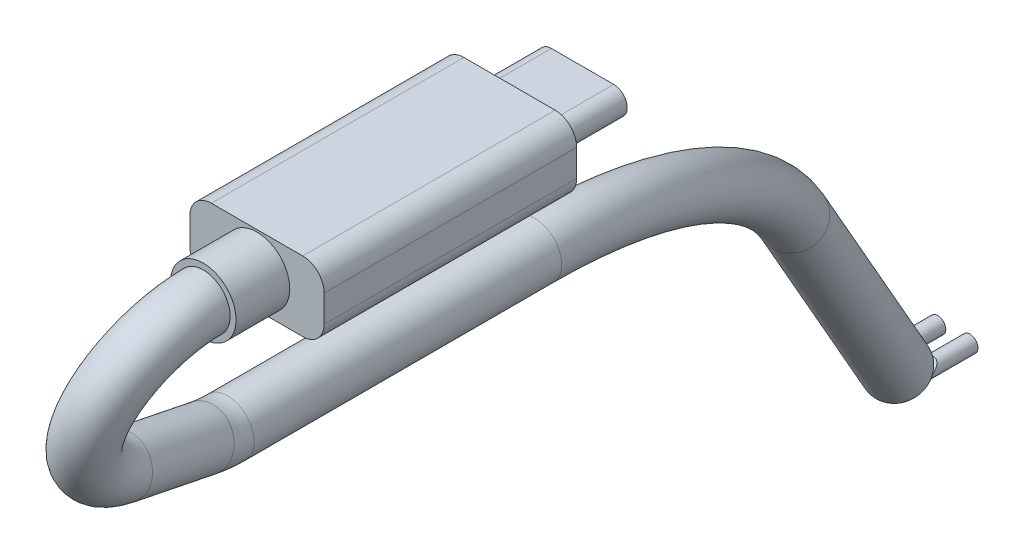
from build123d import *

# Parameters (mm, degrees)
SKETCH1_W                 = 12.5
SKETCH1_H                 = 6.5
BOSS_EXTRUDE1_DEPTH       = 23.5
SKETCH2_R                 = 3.05
BOSS_EXTRUDE2_DEPTH       = 5
SKETCH3_R                 = 2.5
SKETCH5_W                 = 8.3
SKETCH5_H                 = 2.5
BOSS_EXTRUDE3_DEPTH       = 6.8
FILLET1_RADIUS            = 1.25
FILLET1_LENGTH            = 6.8
FILLET2_RADIUS            = 1.25
FILLET2_LENGTH            = 6.8
FILLET3_R                 = 2
BOSS_EXTRUDE6_START       = -62
BOSS_EXTRUDE6_OUTLINE_R   = 0.75
BOSS_EXTRUDE6_DEPTH       = 4.969882251
BOSS_EXTRUDE6_START_2     = -57.030117749
BOSS_EXTRUDE6_2_OUTLINE_R = 0.75
BOSS_EXTRUDE6_2_DEPTH     = 2.202194261
BOSS_EXTRUDE6_START_3     = -82.97383816
BOSS_EXTRUDE6_3_OUTLINE_W = 5
BOSS_EXTRUDE6_3_OUTLINE_H = 6
BOSS_EXTRUDE6_3_DEPTH     = 1.97383816
BOSS_EXTRUDE6_4_OUTLINE_R = 0.75
BOSS_EXTRUDE6_4_DEPTH     = 3.498218139
BOSS_EXTRUDE6_START_4     = -58.501781861
BOSS_EXTRUDE6_5_OUTLINE_R = 0.75
BOSS_EXTRUDE6_5_DEPTH     = 2.20219426
BOSS_EXTRUDE6_6_OUTLINE_W = 5
BOSS_EXTRUDE6_6_OUTLINE_H = 5
BOSS_EXTRUDE6_6_DEPTH     = 1.97383816


with BuildPart() as part:
    # Sketch1 → Boss-Extrude1 (new body)
    with BuildSketch(Plane.XY):
        Rectangle(SKETCH1_W, SKETCH1_H)
    extrude(amount=BOSS_EXTRUDE1_DEPTH)

    # Sketch2 → Boss-Extrude2 (add)
    with BuildSketch(Plane.XY.offset(23.5)):
        Circle(SKETCH2_R)
    extrude(amount=BOSS_EXTRUDE2_DEPTH)

    # Sweep1: sweep along a path in Sketch4
    with BuildLine(Plane(origin=(0, 0, 0), x_dir=(0, 0, -1), z_dir=(0.9425249130903538, -0.3341358828441223, 0))) as sweep1_path:
        Line((56.664852675, -61.796572691), (37.683956267, -33.930161138))
        ThreePointArc((37.683956267, -33.930161138), (25.024855626, -22.609720048), (8.542155439, -18.52))
        Line((8.542155439, -18.52), (-20.063531525, -18.52))
        ThreePointArc((-20.063531525, -18.52), (-21.220526285, -18.435893072), (-22.353193227, -18.185340781))
        Line((-22.353193227, -18.185340781), (-30.789661702, -15.665340781))
        ThreePointArc((-30.789661702, -15.665340781), (-36.415893072, -6.84300524), (-28.5, 0))
    # Sketch3 → Sweep1 (sweep)
    with BuildSketch(Plane.XY.offset(28.5)):
        Circle(SKETCH3_R)
    sweep(path=sweep1_path.line)

    # Sketch5 → Boss-Extrude3 (add)
    with BuildSketch(Plane.XY):
        Rectangle(SKETCH5_W, SKETCH5_H)
    extrude(amount=-BOSS_EXTRUDE3_DEPTH)

    # Fillet1: full round fillet: the end face becomes a half cylinder, R = half its width
    fillet1_face = Plane((4.15, 0, -3.4), x_dir=(0, 0, 1), z_dir=(1, 0, 0))  # on the end face: x along it, z out of the body
    fillet1_slab = fillet1_face.offset(-FILLET1_RADIUS / 2) * Box(FILLET1_LENGTH, 2 * FILLET1_RADIUS, FILLET1_RADIUS, mode=Mode.PRIVATE)  # the body's end, R deep
    fillet1_round = Plane((2.9, 0, -3.4), x_dir=(1, 0, 0), z_dir=(0, 0, 1)) * Cylinder(FILLET1_RADIUS, FILLET1_LENGTH, mode=Mode.PRIVATE)  # its axis R under the face
    add(fillet1_slab - fillet1_round, mode=Mode.SUBTRACT)

    # Fillet2: full round fillet: the end face becomes a half cylinder, R = half its width
    fillet2_face = Plane((-4.15, 0, -3.4), x_dir=(0, 0, 1), z_dir=(-1, 0, 0))  # on the end face: x along it, z out of the body
    fillet2_slab = fillet2_face.offset(-FILLET2_RADIUS / 2) * Box(FILLET2_LENGTH, 2 * FILLET2_RADIUS, FILLET2_RADIUS, mode=Mode.PRIVATE)  # the body's end, R deep
    fillet2_round = Plane((-2.9, 0, -3.4), x_dir=(-1, 0, 0), z_dir=(0, 0, 1)) * Cylinder(FILLET2_RADIUS, FILLET2_LENGTH, mode=Mode.PRIVATE)  # its axis R under the face
    add(fillet2_slab - fillet2_round, mode=Mode.SUBTRACT)

    # Fillet3
    fillet3_edges = [part.edges().sort_by_distance(p)[0] for p in [
        (6.25, -3.25, 11.75),
        (-6.25, -3.25, 11.75),
        (-6.25, 3.25, 11.75),
        (6.25, 3.25, 11.75),
    ]]
    fillet(fillet3_edges, radius=FILLET3_R)


with BuildPart() as body_2:
    # Boss-Extrude6: read off the stored shape, not the designer's step
    # Boss-Extrude6 outline → Boss-Extrude6 (new body)
    with BuildSketch(Plane.XY.offset(BOSS_EXTRUDE6_START)):
        with Locations((-22.148452373, -58.244809305)):
            Circle(BOSS_EXTRUDE6_OUTLINE_R)
    extrude(amount=BOSS_EXTRUDE6_DEPTH)

    # Boss-Extrude6 2 outline → Boss-Extrude6 2 (add)
    with BuildSketch(Plane.XY.offset(BOSS_EXTRUDE6_START_2)):
        with Locations((-22.148452373, -58.244809305)):
            Circle(BOSS_EXTRUDE6_2_OUTLINE_R)
    extrude(amount=BOSS_EXTRUDE6_2_DEPTH)

    # Boss-Extrude6 3 outline → Boss-Extrude6 3 (cut)
    with BuildSketch(Plane(origin=(0, 0, 0), x_dir=(0.9611118234588524, -0.22382868291463434, -0.1617553198887132), z_dir=(0.276159487991269, 0.7789860675917779, 0.5629535004689981)).offset(BOSS_EXTRUDE6_START_3)):
        with Locations((0.5, 11)):
            Rectangle(BOSS_EXTRUDE6_3_OUTLINE_W, BOSS_EXTRUDE6_3_OUTLINE_H)
    extrude(amount=BOSS_EXTRUDE6_3_DEPTH, mode=Mode.SUBTRACT)


with BuildPart() as body_3:
    # Boss-Extrude6 4 outline → Boss-Extrude6 4 (new body)
    with BuildSketch(Plane.XY.offset(BOSS_EXTRUDE6_START)):
        with Locations((-19.148452373, -58.244809305)):
            Circle(BOSS_EXTRUDE6_4_OUTLINE_R)
    extrude(amount=BOSS_EXTRUDE6_4_DEPTH)

    # Boss-Extrude6 5 outline → Boss-Extrude6 5 (add)
    with BuildSketch(Plane.XY.offset(BOSS_EXTRUDE6_START_4)):
        with Locations((-19.148452373, -58.244809305)):
            Circle(BOSS_EXTRUDE6_5_OUTLINE_R)
    extrude(amount=BOSS_EXTRUDE6_5_DEPTH)

    # Boss-Extrude6 6 outline → Boss-Extrude6 6 (cut)
    with BuildSketch(Plane(origin=(0, 0, 0), x_dir=(0.9611118234588528, -0.22382868291463243, -0.16175531988871258), z_dir=(0.2761594879912671, 0.7789860675917771, 0.5629535004690001)).offset(BOSS_EXTRUDE6_START_3)):
        with Locations((3.5, 12.5)):
            Rectangle(BOSS_EXTRUDE6_6_OUTLINE_W, BOSS_EXTRUDE6_6_OUTLINE_H)
    extrude(amount=BOSS_EXTRUDE6_6_DEPTH, mode=Mode.SUBTRACT)


solid = Compound([part.part, body_2.part, body_3.part])
